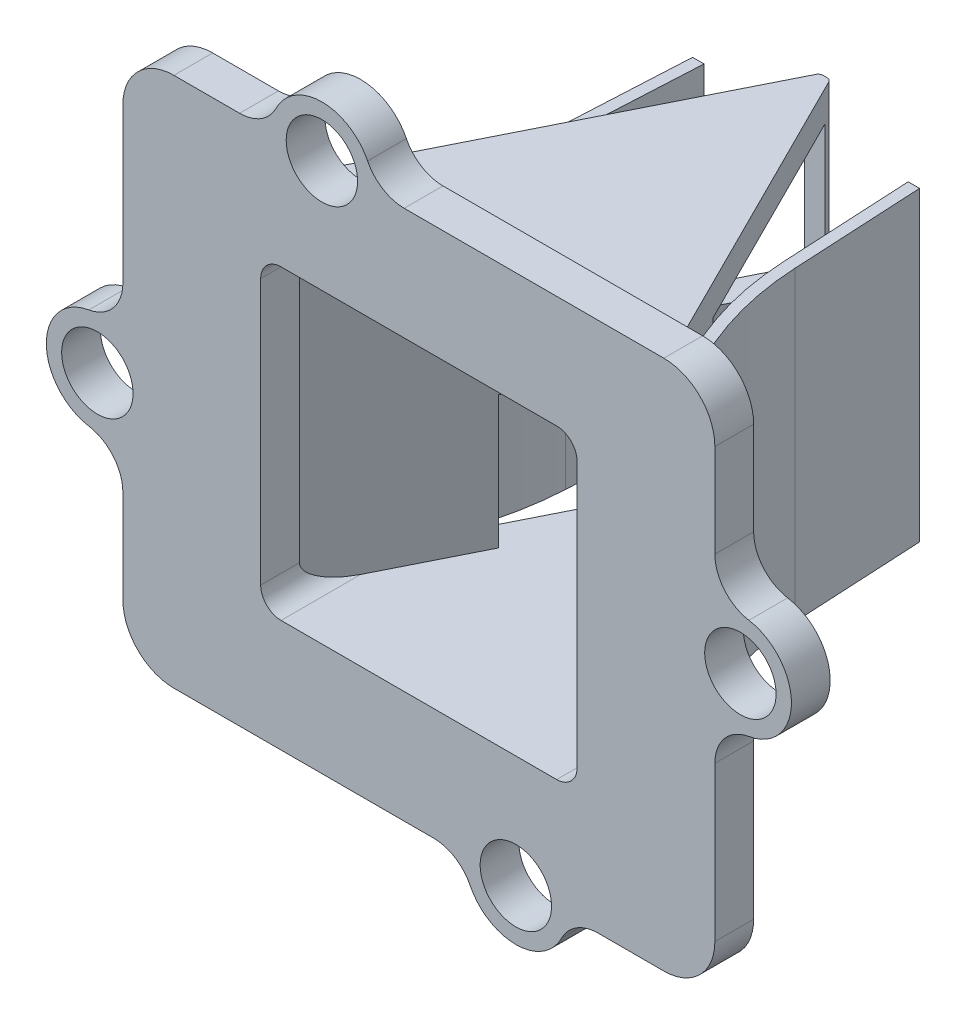
from build123d import *

# Parameters (mm, degrees)
SKETCH_1_R          = 3.5
EXTRUDE_1_DEPTH     = 3.8
LOFT_START          = -18
LOFT_1_DEPTH        = 36
FILLET_1_R          = 0.5
CUT_EXTRUDE_1_DEPTH = 15
FILLET_2_R          = 2
SKETCH_6_W          = 22
SKETCH_6_H          = 13
CUT_EXTRUDE_2_DEPTH = 19
EXTRUDE_2_DEPTH     = 15
SKETCH_8_R          = 2.5
EXTRUDE_3_DEPTH     = 3
FILLET_5_R          = 1
SKETCH_9_R          = 2.5
EXTRUDE_4_DEPTH     = 3
FILLET_6_R          = 1


# Read off the part's stored shape, not the designer's step: По сечениям1
with BuildPart() as part:
    # Эскиз1 → Бобышка-Вытянуть1 (new body)
    with BuildSketch(Plane.XY):
        with BuildLine():
            Line((-24, -26), (1.437742252, -26))
            ThreePointArc((1.437742252, -26), (3.545927358, -26.600653658), (5.020967918, -28.222222222))
            ThreePointArc((5.020967918, -28.222222222), (9.5, -31), (13.979032082, -28.222222222))
            ThreePointArc((13.979032082, -28.222222222), (15.454072642, -26.600653658), (17.562257748, -26))
            Line((17.562257748, -26), (24, -26))
            ThreePointArc((24, -26), (27.535533906, -24.535533906), (29, -21))
            Line((29, -21), (29, -5.874119675))
            ThreePointArc((29, -5.874119675), (29.944949537, -3.292130777), (32.333333333, -1.930066486))
            ThreePointArc((32.333333333, -1.930066486), (36.5, 3), (32.333333333, 7.930066486))
            ThreePointArc((32.333333333, 7.930066486), (29.944949537, 9.292130777), (29, 11.874119675))
            Line((29, 11.874119675), (29, 21))
            ThreePointArc((29, 21), (27.535533906, 24.535533906), (24, 26))
            Line((24, 26), (-1.437742252, 26))
            ThreePointArc((-1.437742252, 26), (-3.545927358, 26.600653658), (-5.020967918, 28.222222222))
            ThreePointArc((-5.020967918, 28.222222222), (-9.5, 31), (-13.979032082, 28.222222222))
            ThreePointArc((-13.979032082, 28.222222222), (-15.454072642, 26.600653658), (-17.562257748, 26))
            Line((-17.562257748, 26), (-24, 26))
            ThreePointArc((-24, 26), (-27.535533906, 24.535533906), (-29, 21))
            Line((-29, 21), (-29, 5.874119675))
            ThreePointArc((-29, 5.874119675), (-29.944949537, 3.292130777), (-32.333333333, 1.930066486))
            ThreePointArc((-32.333333333, 1.930066486), (-36.5, -3), (-32.333333333, -7.930066486))
            ThreePointArc((-32.333333333, -7.930066486), (-29.944949537, -9.292130777), (-29, -11.874119675))
            Line((-29, -11.874119675), (-29, -21))
            ThreePointArc((-29, -21), (-27.535533906, -24.535533906), (-24, -26))
        make_face()
        with Locations(Location((31.5, 3, 0), (0, 0, 180))):
            Circle(SKETCH_1_R, mode=Mode.SUBTRACT)
        with Locations(Location((-9.5, 26, 0), (0, 0, 180))):
            Circle(SKETCH_1_R, mode=Mode.SUBTRACT)
        with Locations(Location((-31.5, -3, 0), (0, 0, 180))):
            Circle(SKETCH_1_R, mode=Mode.SUBTRACT)
        with Locations(Location((9.5, -26, 0), (0, 0, 180))):
            Circle(SKETCH_1_R, mode=Mode.SUBTRACT)
    extrude(amount=EXTRUDE_1_DEPTH)

    # По сечениям1 outline → По сечениям1 (add)
    with BuildSketch(Plane(origin=(0, 0, 0), x_dir=(1, 0, 0), z_dir=(0, 1, 0)).offset(LOFT_START)):
        Polygon((0.5, 36), (-0.5, 36), (-18.5, 0), (18.5, 0), align=None)
    extrude(amount=LOFT_1_DEPTH)

    # Скругление1
    fillet_1_edges = [part.edges().sort_by_distance(p)[0] for p in [
        (0.5, 0, -36),
        (-0.5, 0, -36),
    ]]
    fillet(fillet_1_edges, radius=FILLET_1_R)

    # Эскиз5 → Вырез-Вытянуть1 (cut, symmetric)
    with BuildSketch(Plane(origin=(0, 0, 0), x_dir=(1, 0, 0), z_dir=(0, 1, 0))):
        Polygon((15.5, -5.263726507), (-15.5, -5.263726507), (-15.5, 0), (0, 31), (15.5, 0), align=None)
    extrude(amount=CUT_EXTRUDE_1_DEPTH, both=True, mode=Mode.SUBTRACT)

    # Скругление2
    fillet_2_edges = [part.edges().sort_by_distance(p)[0] for p in [
        (15.5, -15, 1.9),
        (-15.5, -15, 1.9),
        (-15.5, 15, 1.9),
        (15.5, 15, 1.9),
    ]]
    fillet(fillet_2_edges, radius=FILLET_2_R)

    # Эскиз6 → Вырез-Вытянуть2 (cut, symmetric)
    with BuildSketch(Plane(origin=(0, 0, 0), x_dir=(0, 0, -1), z_dir=(1, 0, 0))):
        with Locations((24, 8.5)):
            Rectangle(SKETCH_6_W, SKETCH_6_H)
        with Locations((24, -8.5)):
            Rectangle(SKETCH_6_W, SKETCH_6_H)
    extrude(amount=CUT_EXTRUDE_2_DEPTH, both=True, mode=Mode.SUBTRACT)

    # Эскиз7 → Бобышка-Вытянуть2 (add, symmetric)
    with BuildSketch(Plane(origin=(0, 0, 0), x_dir=(1, 0, 0), z_dir=(0, 1, 0))):
        with BuildLine():
            Line((10, 34.139527531), (10.6733594, 21.251746752))
            ThreePointArc((10.6733594, 21.251746752), (11.624847718, 15.164834748), (13.799679679, 9.400640641))
            Line((13.799679679, 9.400640641), (18.5, 0))
            Line((18.5, 0), (19.394427191, 0.447213595))
            Line((19.394427191, 0.447213595), (14.917713668, 9.400640641))
            ThreePointArc((14.917713668, 9.400640641), (12.742881707, 15.164834748), (11.791393389, 21.251746752))
            Line((11.791393389, 21.251746752), (11.118033989, 34.139527531))
            Line((11.118033989, 34.139527531), (10, 34.139527531))
        make_face()
        with BuildLine():
            Line((-18.5, 0), (-19.394427191, 0.447213595))
            Line((-19.394427191, 0.447213595), (-14.917713668, 9.400640641))
            ThreePointArc((-14.917713668, 9.400640641), (-12.742881707, 15.164834748), (-11.791393389, 21.251746752))
            Line((-11.791393389, 21.251746752), (-11.118033989, 34.139527531))
            Line((-11.118033989, 34.139527531), (-10, 34.139527531))
            Line((-10, 34.139527531), (-10.6733594, 21.251746752))
            ThreePointArc((-10.6733594, 21.251746752), (-11.624847718, 15.164834748), (-13.799679679, 9.400640641))
            Line((-13.799679679, 9.400640641), (-18.5, 0))
        make_face()
    extrude(amount=EXTRUDE_2_DEPTH, both=True)

    # Эскиз8 → Бобышка-Вытянуть3 (add)
    with BuildSketch(Plane(origin=(15.694427191, 0, -7.847213595), x_dir=(-0.4472135954999576, 0, -0.8944271909999162), z_dir=(0.8944271909999162, 0, -0.4472135954999576))):
        with Locations(Location((-3, 10, 0), (0, 0, 180))):
            Circle(SKETCH_8_R)
        with Locations(Location((-3, -10, 0), (0, 0, 180))):
            Circle(SKETCH_8_R)
    extrude(amount=EXTRUDE_3_DEPTH)

    # Скругление5
    fillet_5_edges = [part.edges().sort_by_distance(p)[0] for p in [
        (18.601315562, 10, -8.741640786),
        (18.601315562, -10, -8.741640786),
    ]]
    fillet(fillet_5_edges, radius=FILLET_5_R)

    # Эскиз9 → Бобышка-Вытянуть4 (add)
    with BuildSketch(Plane(origin=(-15.694427191, 0, -7.847213595), x_dir=(-0.4472135954999576, 0, 0.8944271909999162), z_dir=(-0.8944271909999162, 0, -0.4472135954999576))):
        with Locations(Location((3, 10, 0), (0, 0, 180))):
            Circle(SKETCH_9_R)
        with Locations(Location((3, -10, 0), (0, 0, 180))):
            Circle(SKETCH_9_R)
    extrude(amount=EXTRUDE_4_DEPTH)

    # Скругление6
    fillet_6_edges = [part.edges().sort_by_distance(p)[0] for p in [
        (-20.837383539, 10, -4.269504832),
        (-20.837383539, -10, -4.269504832),
    ]]
    fillet(fillet_6_edges, radius=FILLET_6_R)


solid = part.part
